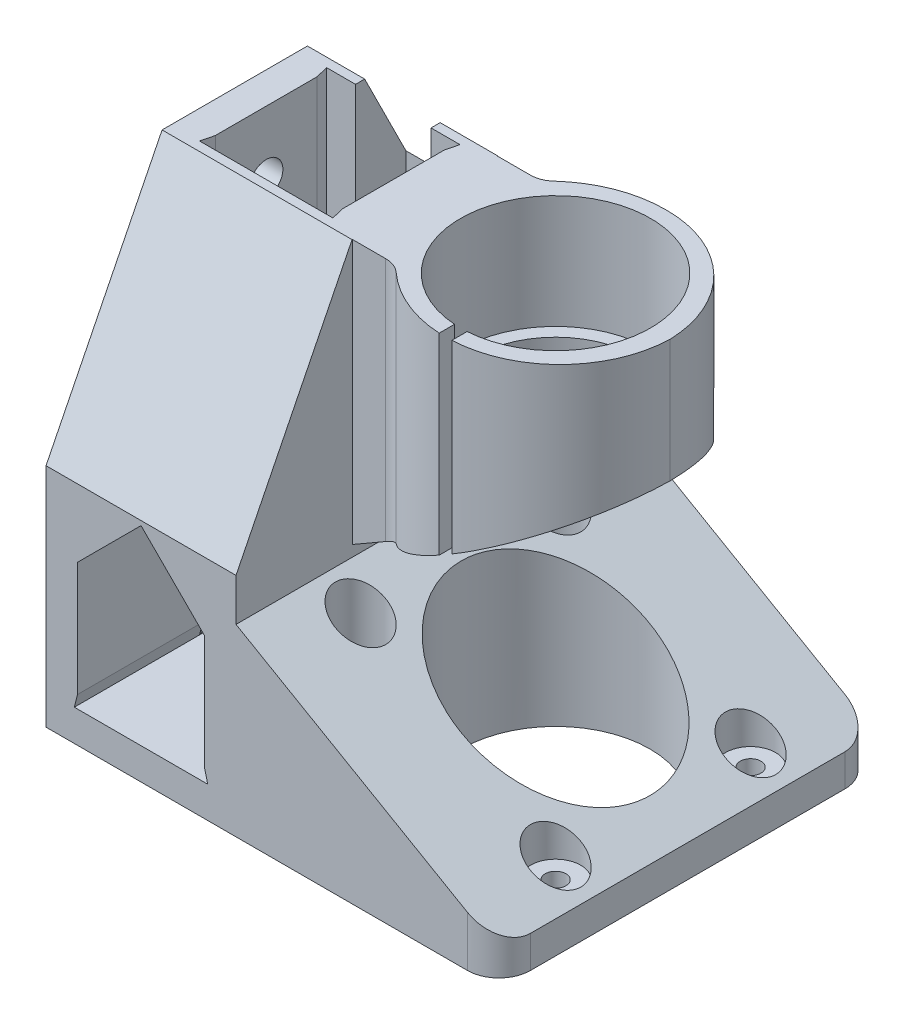
from build123d import *

# Parameters (mm, degrees)
SKETCH1_W               = 72
SKETCH1_H               = 60
BOSS_EXTRUDE1_DEPTH     = 5
SKETCH2_W               = 5
SKETCH2_H               = 60
BOSS_EXTRUDE2_DEPTH     = 68
SKETCH3_W               = 5
SKETCH3_H               = 60
BOSS_EXTRUDE3_DEPTH     = 68
BOSS_EXTRUDE4_DEPTH     = 60
CHAMFER1_SIZE           = 42
CHAMFER1_SIZE_2         = 24.248711306
CUT_EXTRUDE8_REACH      = 120.798
SKETCH12_W              = 20.2
SKETCH12_H              = 20.2
CUT_EXTRUDE1_DEPTH      = 116.792918609
CUT_EXTRUDE1_DEPTH_BACK = 116.792918609
SKETCH5_R               = 15
SKETCH8_R               = 2.65
CUT_EXTRUDE5_DEPTH      = 10
CUT_EXTRUDE6_DEPTH      = 119.798148134
CUT_EXTRUDE6_DEPTH_BACK = 119.798148134
SKETCH9_R               = 2.65
FILLET1_R               = 5
SKETCH10_R              = 2.65
CUT_EXTRUDE7_DEPTH      = 10
CUT_EXTRUDE9_DEPTH      = 119.798148134
CUT_EXTRUDE9_DEPTH_BACK = 119.798148134
CUT_EXTRUDE10_REACH     = 120.798
SKETCH14_W              = 12
SKETCH14_H              = 8
SKETCH15_W              = 35
SKETCH15_H              = 19.5
BOSS_EXTRUDE5_DEPTH     = 39
SKETCH16_R              = 15.1
CUT_EXTRUDE11_DEPTH     = 109.669222874
SKETCH17_R              = 13
CUT_EXTRUDE12_DEPTH     = 108.917792787
FILLET2_R               = 18
CHAMFER2_START          = 51.76396
CHAMFER2_OUTLINE_R      = 13
CHAMFER2_DEPTH          = 1.73604
CHAMFER2_START_2        = 31
CHAMFER2_2_OUTLINE_R    = 13
CHAMFER2_2_DEPTH        = 20.76396
CHAMFER2_START_3        = -47.5
CHAMFER2_3_DEPTH        = 35
SKETCH6_R               = 1.65
CUT_EXTRUDE2_DEPTH      = 119.798148134
SKETCH7_R               = 4
CUT_EXTRUDE4_DEPTH      = 116.792918609
SKETCH18_W              = 2
SKETCH18_H              = 15
CUT_EXTRUDE13_DEPTH     = 40
CHAMFER3_DEPTH          = 34.854175091
CUT_EXTRUDE14_REACH     = 120.798
SKETCH19_W              = 5.3
SKETCH19_H              = 10
FILLET3_R               = 19


with BuildPart() as part:
    # Sketch1 → Boss-Extrude1 (new body)
    with BuildSketch(Plane(origin=(0, 0, 0), x_dir=(1, 0, 0), z_dir=(0, 1, 0))):
        with Locations((36, 30)):
            Rectangle(SKETCH1_W, SKETCH1_H)
    extrude(amount=BOSS_EXTRUDE1_DEPTH)

    # Sketch2 → Boss-Extrude2 (add)
    with BuildSketch(Plane(origin=(0, 5, 0), x_dir=(1, 0, 0), z_dir=(0, 1, 0))):
        with Locations((2.5, 30)):
            Rectangle(SKETCH2_W, SKETCH2_H)
    extrude(amount=BOSS_EXTRUDE2_DEPTH)

    # Sketch3 → Boss-Extrude3 (add)
    with BuildSketch(Plane(origin=(0, 5, 0), x_dir=(1, 0, 0), z_dir=(0, 1, 0))):
        with Locations((27.7, 30)):
            Rectangle(SKETCH3_W, SKETCH3_H)
    extrude(amount=BOSS_EXTRUDE3_DEPTH)

    # Sketch11 → Boss-Extrude4 (add)
    with BuildSketch(Plane(origin=(0, 0, -60), x_dir=(-1, 0, 0), z_dir=(0, 0, -1))):
        Polygon((-25.2, 25.2), (-15.1, 35.3), (-5, 25.2), (-5, 73), (-25.2, 73), align=None)
    extrude(amount=-BOSS_EXTRUDE4_DEPTH)

    # Chamfer1
    # the kernel refuses this chamfer: 42, 24.248711306 mm, written as the material it adds along each edge
    with BuildSketch(Plane(origin=(30.2, 5, -60), x_dir=(1, 0, 0), z_dir=(0, 0, 1))) as chamfer1_piece_1_section:
        Polygon((CHAMFER1_SIZE, 0), (0, CHAMFER1_SIZE_2), (0, 0), align=None)
    chamfer1_piece_1 = extrude(amount=60, mode=Mode.PRIVATE)
    chamfer1_piece_1 = split(chamfer1_piece_1, bisect_by=Plane(origin=(72, 5, -60), z_dir=(-1, 0, 0)), keep=Keep.TOP, mode=Mode.PRIVATE)
    add(chamfer1_piece_1)

    # Cut-Extrude8: up to this face of the body (flat: up to its plane)
    cut_extrude8_end = Plane(part.part.faces().sort_by_distance((15.1, 5, -30))[0])
    # Sketch12 → Cut-Extrude8 (cut, up to the picked face)
    with BuildSketch(Plane(origin=(0, 73, 0), x_dir=(1, 0, 0), z_dir=(0, 1, 0)), mode=Mode.PRIVATE) as cut_extrude8_sk1:
        with Locations((15.1, 30)):
            Rectangle(SKETCH12_W, SKETCH12_H)
    cut_extrude8_tool1 = split(extrude(cut_extrude8_sk1.sketch, amount=-CUT_EXTRUDE8_REACH, mode=Mode.PRIVATE), bisect_by=cut_extrude8_end, keep=Keep.BOTH, mode=Mode.PRIVATE)
    add(cut_extrude8_tool1.solids().sort_by(Axis((15.1, 73, -30), (0, -1, 0)))[0], mode=Mode.SUBTRACT)

    # Sketch5 → Cut-Extrude1 (cut, two sides: drawn at the far end of the back side and taken through both)
    with BuildSketch(Plane(origin=(0, 5, 0), x_dir=(1, 0, 0), z_dir=(0, 1, 0)).offset(-CUT_EXTRUDE1_DEPTH_BACK)):
        with Locations(Location((51, 30, 0), (0, 0, 270))):
            Circle(SKETCH5_R)
    extrude(amount=CUT_EXTRUDE1_DEPTH + CUT_EXTRUDE1_DEPTH_BACK, mode=Mode.SUBTRACT)

    # Sketch8 → Cut-Extrude5 (cut)
    with BuildSketch(Plane(origin=(5, 0, 0), x_dir=(0, 0, -1), z_dir=(1, 0, 0))):
        with Locations((30, 63)):
            Circle(SKETCH8_R)
    extrude(amount=-CUT_EXTRUDE5_DEPTH, mode=Mode.SUBTRACT)

    # Sketch9 → Cut-Extrude6 (cut, two sides: drawn at the far end of the back side and taken through both)
    with BuildSketch(Plane.XZ.offset(-CUT_EXTRUDE6_DEPTH_BACK)):
        with Locations(Location((15, -30, 0), (0, 0, 270))):
            Circle(SKETCH9_R)
    extrude(amount=CUT_EXTRUDE6_DEPTH + CUT_EXTRUDE6_DEPTH_BACK, mode=Mode.SUBTRACT)

    # Fillet1
    fillet1_edges = [part.edges().sort_by_distance(p)[0] for p in [
        (72, 2.557735027, -60),
        (72, 2.557735027, 0),
    ]]
    fillet(fillet1_edges, radius=FILLET1_R)

    # Sketch10 → Cut-Extrude7 (cut)
    with BuildSketch(Plane.ZY):
        with Locations((-30, 15)):
            Circle(SKETCH10_R)
    extrude(amount=-CUT_EXTRUDE7_DEPTH, mode=Mode.SUBTRACT)

    # Sketch13 → Cut-Extrude9 (cut, two sides: drawn at the far end of the back side and taken through both)
    with BuildSketch(Plane.XY.offset(-CUT_EXTRUDE9_DEPTH_BACK)):
        Polygon((5, 5), (4.5, 5), (5, 7), align=None)
        Polygon((25.2, 5), (25.7, 5), (25.2, 7), align=None)
    extrude(amount=CUT_EXTRUDE9_DEPTH + CUT_EXTRUDE9_DEPTH_BACK, mode=Mode.SUBTRACT)

    # Cut-Extrude10: up to this face of the body (flat: up to its plane)
    cut_extrude10_end = Plane(part.part.faces().sort_by_distance((24.566909169, 5, -30))[0])
    # Sketch14 → Cut-Extrude10 (cut, up to the picked face)
    with BuildSketch(Plane(origin=(0, 73, 0), x_dir=(1, 0, 0), z_dir=(0, 1, 0)), mode=Mode.PRIVATE) as cut_extrude10_sk1:
        with Locations((15.1, 44.1)):
            Rectangle(SKETCH14_W, SKETCH14_H)
    cut_extrude10_tool1 = split(extrude(cut_extrude10_sk1.sketch, amount=-CUT_EXTRUDE10_REACH, mode=Mode.PRIVATE), bisect_by=cut_extrude10_end, keep=Keep.BOTH, mode=Mode.PRIVATE)
    # Sketch14 → Cut-Extrude10 (cut, up to the picked face)
    with BuildSketch(Plane(origin=(0, 73, 0), x_dir=(1, 0, 0), z_dir=(0, 1, 0)), mode=Mode.PRIVATE) as cut_extrude10_sk2:
        Polygon((25.2, 19.9), (25.7, 19.9), (25.2, 21.9), align=None)
    cut_extrude10_tool2 = split(extrude(cut_extrude10_sk2.sketch, amount=-CUT_EXTRUDE10_REACH, mode=Mode.PRIVATE), bisect_by=cut_extrude10_end, keep=Keep.BOTH, mode=Mode.PRIVATE)
    # Sketch14 → Cut-Extrude10 (cut, up to the picked face)
    with BuildSketch(Plane(origin=(0, 73, 0), x_dir=(1, 0, 0), z_dir=(0, 1, 0)), mode=Mode.PRIVATE) as cut_extrude10_sk3:
        Polygon((5, 19.9), (4.5, 19.9), (5, 21.9), align=None)
    cut_extrude10_tool3 = split(extrude(cut_extrude10_sk3.sketch, amount=-CUT_EXTRUDE10_REACH, mode=Mode.PRIVATE), bisect_by=cut_extrude10_end, keep=Keep.BOTH, mode=Mode.PRIVATE)
    # Sketch14 → Cut-Extrude10 (cut, up to the picked face)
    with BuildSketch(Plane(origin=(0, 73, 0), x_dir=(1, 0, 0), z_dir=(0, 1, 0)), mode=Mode.PRIVATE) as cut_extrude10_sk4:
        Polygon((25.2, 40.1), (25.7, 40.1), (25.2, 38.1), align=None)
    cut_extrude10_tool4 = split(extrude(cut_extrude10_sk4.sketch, amount=-CUT_EXTRUDE10_REACH, mode=Mode.PRIVATE), bisect_by=cut_extrude10_end, keep=Keep.BOTH, mode=Mode.PRIVATE)
    # Sketch14 → Cut-Extrude10 (cut, up to the picked face)
    with BuildSketch(Plane(origin=(0, 73, 0), x_dir=(1, 0, 0), z_dir=(0, 1, 0)), mode=Mode.PRIVATE) as cut_extrude10_sk5:
        Polygon((5, 40.1), (4.5, 40.1), (5, 38.1), align=None)
    cut_extrude10_tool5 = split(extrude(cut_extrude10_sk5.sketch, amount=-CUT_EXTRUDE10_REACH, mode=Mode.PRIVATE), bisect_by=cut_extrude10_end, keep=Keep.BOTH, mode=Mode.PRIVATE)
    add(cut_extrude10_tool1.solids().sort_by(Axis((15.1, 73, -44.1), (0, -1, 0)))[0], mode=Mode.SUBTRACT)
    add(cut_extrude10_tool2.solids().sort_by(Axis((25.366667, 73, -20.566667), (0, -1, 0)))[0], mode=Mode.SUBTRACT)
    add(cut_extrude10_tool3.solids().sort_by(Axis((4.833333, 73, -20.566667), (0, -1, 0)))[0], mode=Mode.SUBTRACT)
    add(cut_extrude10_tool4.solids().sort_by(Axis((25.366667, 73, -39.433333), (0, -1, 0)))[0], mode=Mode.SUBTRACT)
    add(cut_extrude10_tool5.solids().sort_by(Axis((4.833333, 73, -39.433333), (0, -1, 0)))[0], mode=Mode.SUBTRACT)

    # Sketch15 → Boss-Extrude5 (add)
    with BuildSketch(Plane(origin=(30.2, 0, 0), x_dir=(0, 0, -1), z_dir=(1, 0, 0))):
        with Locations((30, 63.25)):
            Rectangle(SKETCH15_W, SKETCH15_H)
    extrude(amount=BOSS_EXTRUDE5_DEPTH)

    # Sketch16 → Cut-Extrude11 (cut, through all)
    with BuildSketch(Plane.XZ.offset(-55)):
        with Locations(Location((51, -30, 0), (0, 0, 270))):
            Circle(SKETCH16_R)
    extrude(amount=-CUT_EXTRUDE11_DEPTH, mode=Mode.SUBTRACT)

    # Sketch17 → Cut-Extrude12 (cut, through all)
    with BuildSketch(Plane.XZ.offset(-53.5)):
        with Locations(Location((51, -30, 0), (0, 0, 270))):
            Circle(SKETCH17_R)
    extrude(amount=-CUT_EXTRUDE12_DEPTH, mode=Mode.SUBTRACT)

    # Fillet2
    # the kernel refuses this fillet: 18 mm, written as the material it takes off along each edge
    with BuildSketch(Plane(origin=(69.2, 53.5, -47.5), x_dir=(-1, 0, 0), z_dir=(0, 1, 0)), Plane(origin=(69.2, 118, -12.5), x_dir=(-1, 0, 0), z_dir=(0, -1, 0))) as fillet2_piece_1:
        with BuildLine():
            CenterArc((FILLET2_R, FILLET2_R), FILLET2_R, 180, 90)
            Line((0, FILLET2_R), (0, 0))
            Line((0, 0), (FILLET2_R, 0))
        make_face()
    extrude(amount=64.5, mode=Mode.SUBTRACT)

    # Chamfer2: read off the stored shape, not the designer's step
    # Chamfer2 outline → Chamfer2 (add)
    with BuildSketch(Plane(origin=(0, 0, 0), x_dir=(1, 0, 0), z_dir=(0, 1, 0)).offset(CHAMFER2_START)):
        with BuildLine():
            Line((30.2, 12.5), (51.2, 12.5))
            ThreePointArc((51.2, 12.5), (63.749900398, 17.596512099), (69.193054215, 30))
            ThreePointArc((69.193054215, 30), (63.749900398, 42.403487901), (51.2, 47.5))
            Line((51.2, 47.5), (30.2, 47.5))
            Line((30.2, 47.5), (30.2, 12.5))
        make_face()
        with Locations((51, 30)):
            Circle(CHAMFER2_OUTLINE_R, mode=Mode.SUBTRACT)
    extrude(amount=CHAMFER2_DEPTH)

    # Chamfer2 2 outline → Chamfer2 2 (add)
    with BuildSketch(Plane(origin=(0, 0, 0), x_dir=(1, 0, 0), z_dir=(0, 1, 0)).offset(CHAMFER2_START_2)):
        with BuildLine():
            Line((30.2, 12.5), (51.2, 12.5))
            ThreePointArc((51.2, 12.5), (63.749900398, 17.596512099), (69.193054215, 30))
            ThreePointArc((69.193054215, 30), (63.749900398, 42.403487901), (51.2, 47.5))
            Line((51.2, 47.5), (30.2, 47.5))
            Line((30.2, 47.5), (30.2, 12.5))
        make_face()
        with Locations((51, 30)):
            Circle(CHAMFER2_2_OUTLINE_R, mode=Mode.SUBTRACT)
    extrude(amount=CHAMFER2_2_DEPTH)

    # Chamfer2 3 outline → Chamfer2 3 (cut)
    with BuildSketch(Plane.XY.offset(CHAMFER2_START_3)):
        Polygon((71, 53.5), (69.17114317, 53.5), (30.2, 31), (71, 31), align=None)
    extrude(amount=CHAMFER2_3_DEPTH, mode=Mode.SUBTRACT)

    # Sketch6 → Cut-Extrude2 (cut, through all)
    with BuildSketch(Plane.XZ):
        with Locations(Location((66.5, -14.5, 0), (0, 0, 270))):
            Circle(SKETCH6_R)
        with Locations(Location((66.5, -45.5, 0), (0, 0, 270))):
            Circle(SKETCH6_R)
        with Locations(Location((35.5, -45.5, 0), (0, 0, 270))):
            Circle(SKETCH6_R)
        with Locations(Location((35.5, -14.5, 0), (0, 0, 270))):
            Circle(SKETCH6_R)
    extrude(amount=-CUT_EXTRUDE2_DEPTH, mode=Mode.SUBTRACT)

    # Sketch7 → Cut-Extrude4 (cut, through all)
    with BuildSketch(Plane(origin=(0, 5, 0), x_dir=(1, 0, 0), z_dir=(0, 1, 0))):
        with Locations((66.5, 45.5)):
            Circle(SKETCH7_R)
        with Locations((66.5, 14.5)):
            Circle(SKETCH7_R)
        with Locations((35.5, 14.5)):
            Circle(SKETCH7_R)
        with Locations((35.5, 45.5)):
            Circle(SKETCH7_R)
    extrude(amount=CUT_EXTRUDE4_DEPTH, mode=Mode.SUBTRACT)

    # Sketch18 → Cut-Extrude13 (cut)
    with BuildSketch(Plane(origin=(0, 73, 0), x_dir=(1, 0, 0), z_dir=(0, 1, 0))):
        with Locations((51, 15)):
            Rectangle(SKETCH18_W, SKETCH18_H)
    extrude(amount=-CUT_EXTRUDE13_DEPTH, mode=Mode.SUBTRACT)

    # Chamfer3: read off the stored shape, not the designer's step
    # Chamfer3 outline → Chamfer3 (cut)
    with BuildSketch(Plane.YZ):
        Polygon((73, -41.552480502), (36, -60), (73, -60), align=None)
        Polygon((73, -18.447519498), (73, 0), (36, 0), align=None)
    extrude(amount=CHAMFER3_DEPTH, mode=Mode.SUBTRACT)

    # Cut-Extrude14: up to this plane
    cut_extrude14_end = Plane(origin=(69.17114317, 53.5, -12.5), z_dir=(0.4999999999999951, -0.8660254037844415, 0))
    # Sketch19 → Cut-Extrude14 (cut, up to the surface)
    with BuildSketch(Plane(origin=(0, 73, 0), x_dir=(1, 0, 0), z_dir=(0, 1, 0)), mode=Mode.PRIVATE) as cut_extrude14_sk1:
        with Locations((32.85, 46.5)):
            Rectangle(SKETCH19_W, SKETCH19_H)
    cut_extrude14_tool1 = split(extrude(cut_extrude14_sk1.sketch, amount=-CUT_EXTRUDE14_REACH, mode=Mode.PRIVATE), bisect_by=cut_extrude14_end, keep=Keep.BOTH, mode=Mode.PRIVATE)
    add(cut_extrude14_tool1.solids().sort_by_distance((32.85, 73, -46.5))[0], mode=Mode.SUBTRACT)
    # Sketch19 → Cut-Extrude14 (cut, up to the surface)
    with BuildSketch(Plane(origin=(0, 73, 0), x_dir=(1, 0, 0), z_dir=(0, 1, 0)), mode=Mode.PRIVATE) as cut_extrude14_sk2:
        with Locations((32.85, 13.5)):
            Rectangle(SKETCH19_W, SKETCH19_H)
    cut_extrude14_tool2 = split(extrude(cut_extrude14_sk2.sketch, amount=-CUT_EXTRUDE14_REACH, mode=Mode.PRIVATE), bisect_by=cut_extrude14_end, keep=Keep.BOTH, mode=Mode.PRIVATE)
    add(cut_extrude14_tool2.solids().sort_by_distance((32.85, 73, -13.5))[0], mode=Mode.SUBTRACT)

    # Fillet3
    # the kernel refuses this fillet: 19 mm, written as the material it takes off along each edge
    with BuildSketch(Plane(origin=(38.964101615, 103.069579424, -47.5), x_dir=(-0.15348078303454, 0, 0.9881516327159028), z_dir=(0, -1, 0))) as fillet3_piece_1:
        with BuildLine():
            CenterArc((16.928839983, -14.801456479), FILLET3_R, 128.828697274, 42.342605452)
            Line((-1.846041038, -11.885321601), (0, 0))
            ThreePointArc((0, 0), (2.507976294, -0.883903899), (5.015952588, 0))
        make_face()
    extrude(amount=49.569579424, mode=Mode.SUBTRACT)
    with BuildSketch(Plane(origin=(38.964101615, 100.589745962, -12.5), x_dir=(1, 0, 0), z_dir=(0, -1, 0))) as fillet3_piece_2:
        with BuildLine():
            CenterArc((12.057965975, -18.972490027), FILLET3_R, 93.083602032, 39.360648152)
            ThreePointArc((-0.764611599, -4.951737396), (0.489047921, -2.610416859), (0, 0))
            Line((0, 0), (11.035898385, 0))
        make_face()
    extrude(amount=47.089745962, mode=Mode.SUBTRACT)
    with BuildSketch(Plane(origin=(38.964101615, 53.5, -12.5), x_dir=(1, 0, 0), z_dir=(0, -1, 0))) as fillet3_piece_3:
        with BuildLine():
            CenterArc((12.057965975, -18.972490027), FILLET3_R, 93.083602032, 39.360648152)
            ThreePointArc((-0.764611599, -4.951737396), (0.489047921, -2.610416859), (0, 0))
            Line((0, 0), (11.035898385, 0))
        make_face()
    extrude(amount=1.73604, mode=Mode.SUBTRACT)
    with BuildSketch(Plane(origin=(38.964101615, 51.76396, -12.5), x_dir=(1, 0, 0), z_dir=(0, -1, 0))) as fillet3_piece_4_section:
        with BuildLine():
            CenterArc((12.057965975, -18.972490027), FILLET3_R, 93.083602032, 39.360648152)
            ThreePointArc((-0.764611599, -4.951737396), (0.489047921, -2.610416859), (0, 0))
            Line((0, 0), (11.035898385, 0))
        make_face()
    fillet3_piece_4 = extrude(amount=43.293749535, mode=Mode.PRIVATE)
    fillet3_piece_4 = split(fillet3_piece_4, bisect_by=Plane(origin=(45.764134633, 39.98595732, -12.5), z_dir=(-0.5000000000028844, 0.8660254037827734, 0)), keep=Keep.TOP, mode=Mode.PRIVATE)
    add(fillet3_piece_4, mode=Mode.SUBTRACT)
    with BuildSketch(Plane(origin=(38.964101615, 53.5, -47.5), x_dir=(1, 0, 0), z_dir=(0, -1, 0))) as fillet3_piece_5_section:
        with BuildLine():
            CenterArc((12.02783177, 19), FILLET3_R, 227.657394548, 42.342605452)
            ThreePointArc((-0.769852331, 4.956521739), (0.488504916, 2.613923132), (0, 0))
            Line((0, 0), (12.02783177, 0))
        make_face()
    fillet3_piece_5 = extrude(amount=31.805619424, mode=Mode.PRIVATE)
    fillet3_piece_5 = split(fillet3_piece_5, bisect_by=Plane(origin=(46.515862004, 40.41996732, -47.5), z_dir=(-0.5000000000028844, 0.8660254037827734, 0)), keep=Keep.TOP, mode=Mode.PRIVATE)
    add(fillet3_piece_5, mode=Mode.SUBTRACT)


solid = part.part
